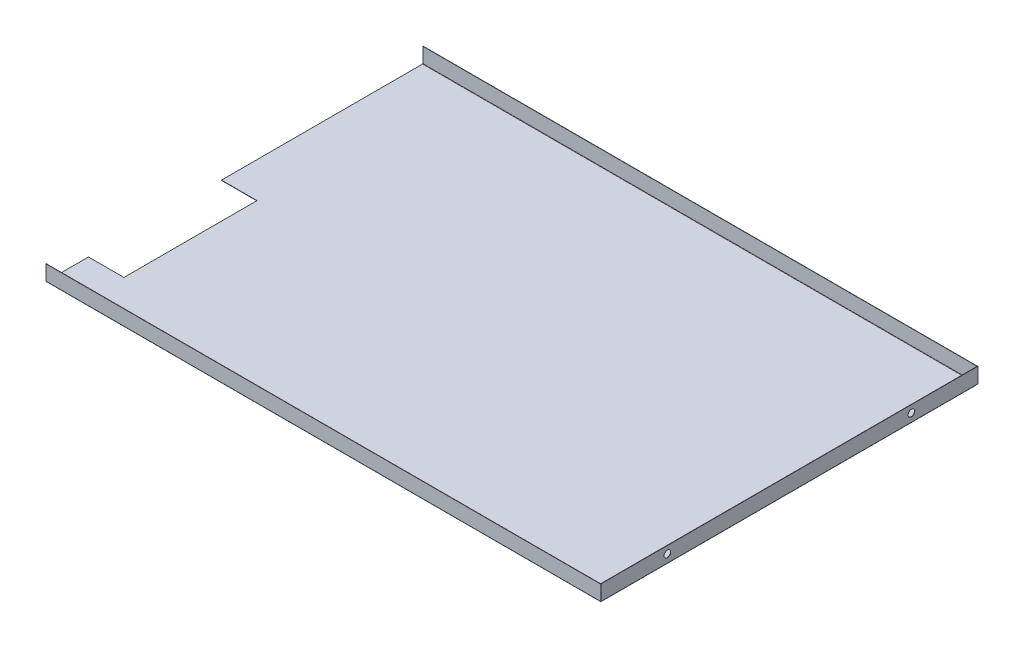
from build123d import *

# Parameters (mm, degrees)
BASE_FLANGE1_DEPTH             = 170
EDGE_FLANGE1_STRIP_W           = 0.762
EDGE_FLANGE1_STRIP_H           = 0.127
EDGE_FLANGE1_STRIP_CUT_DEPTH   = 249.873
EDGE_FLANGE1_STRIP_2_W         = 0.762
EDGE_FLANGE1_STRIP_2_H         = 0.127
EDGE_FLANGE1_STRIP_CUT_2_DEPTH = 249.873
EDGE_FLANGE1_DEPTH             = 249.873
EDGE_FLANGE1_BEND_DEPTH        = 249.873
SKETCH19_W                     = 16
SKETCH19_H                     = 60
CUT_EXTRUDE1_DEPTH             = 10
SKETCH20_R                     = 1.5
CUT_EXTRUDE2_DEPTH             = 10


# Sheet-metal steps are written as plain solids
with BuildPart() as part:
    # Sketch1 → Base-Flange1 (new body)
    with BuildSketch(Plane.XY):
        with BuildLine():
            Line((0, 0), (249.873, 0))
            ThreePointArc((249.873, 0), (249.962802561, 0.037197439), (250, 0.127))
            Line((250, 0.127), (250, 7))
            Line((250, 7), (250.127, 7))
            Line((250.127, 7), (250.127, 0.127))
            ThreePointArc((250.127, 0.127), (250.052605122, -0.052605122), (249.873, -0.127))
            Line((249.873, -0.127), (0, -0.127))
            Line((0, -0.127), (0, 0))
        make_face()
    extrude(amount=BASE_FLANGE1_DEPTH)

    # Edge-Flange1 strip (across the edge) → Edge-Flange1 strip cut (cut)
    with BuildSketch(Plane.ZY.offset(-249.873)):
        with Locations((-0.127, -0.0635)):
            Rectangle(EDGE_FLANGE1_STRIP_W, EDGE_FLANGE1_STRIP_H)
    extrude(amount=EDGE_FLANGE1_STRIP_CUT_DEPTH, mode=Mode.SUBTRACT)

    # Edge-Flange1 strip 2 (across the edge) → Edge-Flange1 strip cut 2 (cut)
    with BuildSketch(Plane(origin=(0, 0, 170), x_dir=(0, 0, -1), z_dir=(1, 0, 0))):
        with Locations((-0.127, -0.0635)):
            Rectangle(EDGE_FLANGE1_STRIP_2_W, EDGE_FLANGE1_STRIP_2_H)
    extrude(amount=EDGE_FLANGE1_STRIP_CUT_2_DEPTH, mode=Mode.SUBTRACT)

    # Edge-Flange1 section (across the edge) → Edge-Flange1 (add)
    with BuildSketch(Plane.ZY.offset(-249.873)):
        with BuildLine():
            Line((0, 0.127), (0, 6.873))
            Line((0, 6.873), (0.127, 6.873))
            Line((0.127, 6.873), (0.127, 0.127))
            ThreePointArc((0.127, 0.127), (0.164197439, 0.037197439), (0.254, 0))
            Line((0.254, 0), (0.254, -0.127))
            ThreePointArc((0.254, -0.127), (0.074394878, -0.052605122), (0, 0.127))
        make_face()
    extrude(amount=EDGE_FLANGE1_DEPTH)

    # Edge-Flange1 section 2 (across the edge) → Edge-Flange1 bend (add)
    with BuildSketch(Plane(origin=(0, 0, 170), x_dir=(0, 0, -1), z_dir=(1, 0, 0))):
        with BuildLine():
            Line((0, 0.127), (0, 6.873))
            Line((0, 6.873), (0.127, 6.873))
            Line((0.127, 6.873), (0.127, 0.127))
            ThreePointArc((0.127, 0.127), (0.164197439, 0.037197439), (0.254, 0))
            Line((0.254, 0), (0.254, -0.127))
            ThreePointArc((0.254, -0.127), (0.074394878, -0.052605122), (0, 0.127))
        make_face()
    extrude(amount=EDGE_FLANGE1_BEND_DEPTH)

    # Sketch19 → Cut-Extrude1 (cut)
    with BuildSketch(Plane(origin=(0, 0, 0), x_dir=(1, 0, 0), z_dir=(0, 1, 0))):
        with Locations((8, -120.873)):
            Rectangle(SKETCH19_W, SKETCH19_H)
    extrude(amount=-CUT_EXTRUDE1_DEPTH, mode=Mode.SUBTRACT)

    # Sketch20 → Cut-Extrude2 (cut)
    with BuildSketch(Plane.ZY.offset(-250)):
        with Locations((30, 3.694801823)):
            Circle(SKETCH20_R)
        with Locations((140, 3.694801823)):
            Circle(SKETCH20_R)
    extrude(amount=-CUT_EXTRUDE2_DEPTH, mode=Mode.SUBTRACT)


solid = part.part
